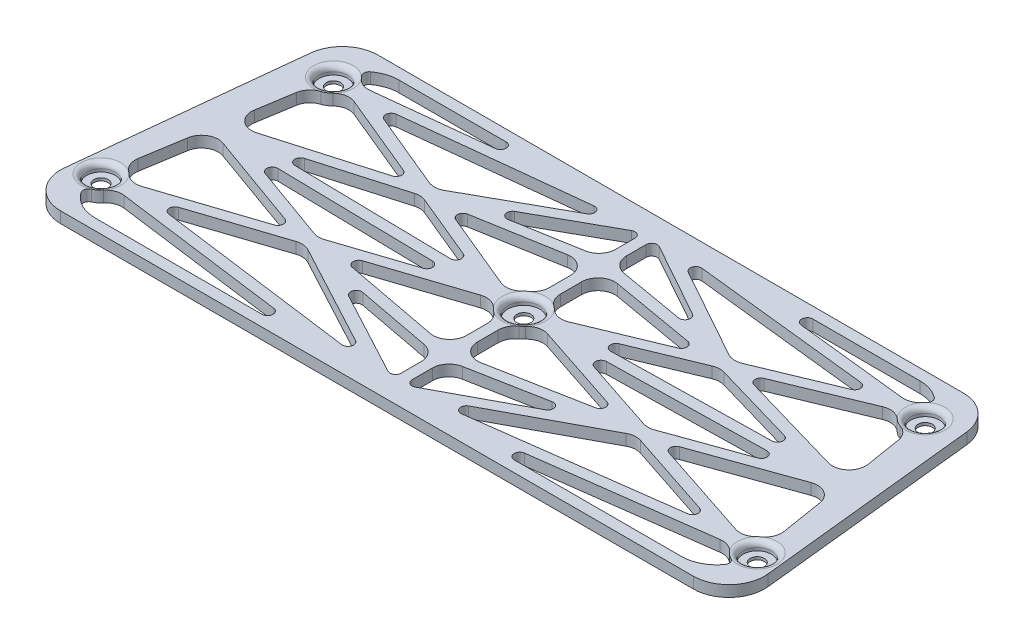
from build123d import *

# Parameters (mm, degrees)
SKETCH1_R                 = 2.032
PLATW_DEPTH               = 3.175
FILLET1_R                 = 10.16
FILLET2_R                 = 10.16
SKETCH2_R                 = 4.064
SKETCH2_R_2               = 4.572
COUNTERSINKS_DEPTH        = 2.38125
POCKET_1_DEPTH            = 109.902861922
ACUTE_ANGLES_R            = 1.5875
FILLET5_R                 = 4.7625
ACUTE_ANGLES_OF_MIRROR1_R = 1.5875
FILLET5_OF_MIRROR1_R      = 4.7625
FILLET6_R                 = 1.5875


with BuildPart() as part:
    # Sketch1 → platw (new body)
    with BuildSketch(Plane(origin=(0, 0, 0), x_dir=(1, 0, 0), z_dir=(0, 1, 0))):
        Polygon((-92.71, 41.91), (-101.6, -41.91), (101.6, -41.91), (92.71, 41.91), align=None)
        with Locations(Location((-93.6752, -27.02052, 0), (0, 0, 270))):
            Circle(SKETCH1_R, mode=Mode.SUBTRACT)
        with Locations(Location((93.6752, -27.02052, 0), (0, 0, 270))):
            Circle(SKETCH1_R, mode=Mode.SUBTRACT)
        with Locations(Location((0, 0, 0), (0, 0, 270))):
            Circle(SKETCH1_R, mode=Mode.SUBTRACT)
        with Locations(Location((-84.4677, 30.12948, 0), (0, 0, 270))):
            Circle(SKETCH1_R, mode=Mode.SUBTRACT)
        with Locations(Location((84.4677, 30.12948, 0), (0, 0, 270))):
            Circle(SKETCH1_R, mode=Mode.SUBTRACT)
    extrude(amount=PLATW_DEPTH)

    # Fillet1
    fillet1_edges = [part.edges().sort_by_distance(p)[0] for p in [
        (-101.6, 1.5875, 41.91),
        (101.6, 1.5875, 41.91),
    ]]
    fillet(fillet1_edges, radius=FILLET1_R)

    # Fillet2
    fillet2_edges = [part.edges().sort_by_distance(p)[0] for p in [
        (-92.71, 1.5875, -41.91),
        (92.71, 1.5875, -41.91),
    ]]
    fillet(fillet2_edges, radius=FILLET2_R)

    # Sketch2 → countersinks (cut)
    with BuildSketch(Plane(origin=(0, 3.175, 0), x_dir=(1, 0, 0), z_dir=(0, 1, 0))):
        with Locations(Location((-84.4677, 30.12948, 0), (0, 0, 270))):
            Circle(SKETCH2_R)
        with Locations(Location((-93.6752, -27.02052, 0), (0, 0, 270))):
            Circle(SKETCH2_R)
        with Locations(Location((93.6752, -27.02052, 0), (0, 0, 270))):
            Circle(SKETCH2_R)
        with Locations(Location((84.4677, 30.12948, 0), (0, 0, 270))):
            Circle(SKETCH2_R)
        with Locations(Location((0, 0, 0), (0, 0, 270))):
            Circle(SKETCH2_R_2)
    extrude(amount=-COUNTERSINKS_DEPTH, mode=Mode.SUBTRACT)

    # Sketch3 → pocket 1 (cut, through all)
    with BuildSketch(Plane(origin=(0, 3.175, 0), x_dir=(1, 0, 0), z_dir=(0, 1, 0))):
        with BuildLine():
            ThreePointArc((-74.364764768, 38.735), (-78.591201304, 37.82143755), (-82.063014065, 35.243865379))
            ThreePointArc((-82.063014065, 35.243865379), (-80.169437747, 33.798866033), (-79.039395327, 31.702044984))
            Line((-79.039395327, 31.702044984), (-14.625996814, 38.735))
            Line((-14.625996814, 38.735), (-74.364764768, 38.735))
        make_face()
        Polygon((-42.58936275, 16.825418377), (-72.487275485, 29.223566982), (-7.622235656, 36.305834302), align=None)
        Polygon((-1.5875, 23.782698651), (-1.5875, 36.033361538), (-33.544297419, 18.230020026), align=None)
        Polygon((-14.510286346, 1.744344238), (-78.575962572, 2.945483668), (-42.581032589, 13.384798421), align=None)
        with BuildLine():
            ThreePointArc((-79.053425075, 28.509270356), (-81.465003698, 25.341655111), (-85.366627548, 24.549929703))
            Line((-85.366627548, 24.549929703), (-88.792093639, 3.288416033))
            Line((-88.792093639, 3.288416033), (-47.272123562, 15.330112916))
            Line((-47.272123562, 15.330112916), (-79.053425075, 28.509270356))
        make_face()
        with BuildLine():
            ThreePointArc((-5.940520688, 1.627775848), (-4.34064828, 4.370150199), (-1.5875, 5.951410253))
            Line((-1.5875, 5.951410253), (-1.5875, 20.560126711))
            Line((-1.5875, 20.560126711), (-36.829028324, 14.436707069))
            Line((-36.829028324, 14.436707069), (-5.940520688, 1.627775848))
        make_face()
        Polygon((-47.069994654, -11.831390316), (-15.504079367, -1.412581541), (-79.443911185, -0.213801513), align=None)
        with BuildLine():
            Line((-51.96640923, -13.44752616), (-89.328331869, -0.039959186))
            Line((-89.328331869, -0.039959186), (-92.776272452, -21.440969703))
            ThreePointArc((-92.776272452, -21.440969703), (-89.939627792, -22.779653045), (-88.253688461, -25.424692666))
            Line((-88.253688461, -25.424692666), (-51.96640923, -13.44752616))
        make_face()
        Polygon((-8.451707544, -36.008722774), (-47.240798441, -15.231243718), (-80.956343198, -26.359570282), align=None)
        Polygon((-1.5875, -36.083749172), (-1.5875, -23.761810906), (-37.213033792, -17.00083784), align=None)
        with BuildLine():
            Line((-1.5875, -20.530141224), (-1.5875, -5.951410253))
            ThreePointArc((-1.5875, -5.951410253), (-4.350190086, -4.360652069), (-5.947579819, -1.601791044))
            Line((-5.947579819, -1.601791044), (-40.767446467, -13.094615785))
            Line((-40.767446467, -13.094615785), (-1.5875, -20.530141224))
        make_face()
        with BuildLine():
            Line((-12.033794896, -38.735), (-88.246680031, -28.592341618))
            ThreePointArc((-88.246680031, -28.592341618), (-90.007286578, -31.320038971), (-92.978310183, -32.628888464))
            ThreePointArc((-92.978310183, -32.628888464), (-89.251887548, -37.071588185), (-83.696991725, -38.735))
            Line((-83.696991725, -38.735), (-12.033794896, -38.735))
        make_face()
    pocket_1 = extrude(amount=-POCKET_1_DEPTH, mode=Mode.SUBTRACT)

    # acute angles
    acute_angles_edges = [part.edges().sort_by_distance(p)[0] for p in [
        (-36.829028324, 1.5875, -14.436707069),
        (-15.504079367, 1.5875, 1.412581541),
        (-79.443911185, 1.5875, 0.213801513),
        (-8.451707544, 1.5875, 36.008722774),
        (-80.956343198, 1.5875, 26.359570282),
        (-51.96640923, 1.5875, 13.44752616),
        (-1.5875, 1.5875, -36.033361538),
        (-33.544297419, 1.5875, -18.230020026),
        (-72.487275485, 1.5875, -29.223566982),
        (-7.622235656, 1.5875, -36.305834302),
        (-47.272123562, 1.5875, -15.330112916),
        (-14.510286346, 1.5875, -1.744344238),
        (-78.575962572, 1.5875, -2.945483668),
        (-12.033794896, 1.5875, 38.735),
        (-92.978310183, 1.5875, 32.628888464),
        (-1.5875, 1.5875, 36.083749172),
        (-37.213033792, 1.5875, 17.00083784),
        (-40.767446467, 1.5875, 13.094615785),
        (-82.063014065, 1.5875, -35.243865379),
        (-14.625996814, 1.5875, -38.735),
    ]]
    fillet(acute_angles_edges, radius=ACUTE_ANGLES_R)

    # Fillet5
    fillet5_edges = [part.edges().sort_by_distance(p)[0] for p in [
        (-1.5875, 1.5875, -5.951410253),
        (-5.940520688, 1.5875, -1.627775848),
        (-1.5875, 1.5875, -20.560126711),
        (-47.069994654, 1.5875, 11.831390316),
        (-47.240798441, 1.5875, 15.231243718),
        (-92.776272452, 1.5875, 21.440969703),
        (-89.328331869, 1.5875, 0.039959186),
        (-88.253688461, 1.5875, 25.424692666),
        (-1.5875, 1.5875, -23.782698651),
        (-42.58936275, 1.5875, -16.825418377),
        (-85.366627548, 1.5875, -24.549929703),
        (-79.053425075, 1.5875, -28.509270356),
        (-88.792093639, 1.5875, -3.288416033),
        (-42.581032589, 1.5875, -13.384798421),
        (-88.246680031, 1.5875, 28.592341618),
        (-1.5875, 1.5875, 23.761810906),
        (-5.947579819, 1.5875, 1.601791044),
        (-1.5875, 1.5875, 5.951410253),
        (-1.5875, 1.5875, 20.530141224),
        (-79.039395327, 1.5875, -31.702044984),
    ]]
    fillet(fillet5_edges, radius=FILLET5_R)

    # Mirror1: pocket 1 across plane
    add(pocket_1.mirror(Plane.ZY), mode=Mode.SUBTRACT)

    # acute angles of Mirror1
    acute_angles_of_mirror1_edges = [part.edges().sort_by_distance(p)[0] for p in [
        (36.829028324, 1.5875, -14.436707069),
        (15.504079367, 1.5875, 1.412581541),
        (79.443911185, 1.5875, 0.213801513),
        (8.451707544, 1.5875, 36.008722774),
        (80.956343198, 1.5875, 26.359570282),
        (51.96640923, 1.5875, 13.44752616),
        (1.5875, 1.5875, -36.033361538),
        (33.544297419, 1.5875, -18.230020026),
        (72.487275485, 1.5875, -29.223566982),
        (7.622235656, 1.5875, -36.305834302),
        (47.272123562, 1.5875, -15.330112916),
        (14.510286346, 1.5875, -1.744344238),
        (78.575962572, 1.5875, -2.945483668),
        (12.033794896, 1.5875, 38.735),
        (92.978310183, 1.5875, 32.628888464),
        (1.5875, 1.5875, 36.083749172),
        (37.213033792, 1.5875, 17.00083784),
        (40.767446467, 1.5875, 13.094615785),
        (82.063014065, 1.5875, -35.243865379),
        (14.625996814, 1.5875, -38.735),
    ]]
    fillet(acute_angles_of_mirror1_edges, radius=ACUTE_ANGLES_OF_MIRROR1_R)

    # Fillet5 of Mirror1
    fillet5_of_mirror1_edges = [part.edges().sort_by_distance(p)[0] for p in [
        (1.5875, 1.5875, -5.951410253),
        (5.940520688, 1.5875, -1.627775848),
        (1.5875, 1.5875, -20.560126711),
        (47.069994654, 1.5875, 11.831390316),
        (47.240798441, 1.5875, 15.231243718),
        (92.776272452, 1.5875, 21.440969703),
        (89.328331869, 1.5875, 0.039959186),
        (88.253688461, 1.5875, 25.424692666),
        (1.5875, 1.5875, -23.782698651),
        (42.58936275, 1.5875, -16.825418377),
        (85.366627548, 1.5875, -24.549929703),
        (79.053425075, 1.5875, -28.509270356),
        (88.792093639, 1.5875, -3.288416033),
        (42.581032589, 1.5875, -13.384798421),
        (88.246680031, 1.5875, 28.592341618),
        (1.5875, 1.5875, 23.761810906),
        (5.947579819, 1.5875, 1.601791044),
        (1.5875, 1.5875, 5.951410253),
        (1.5875, 1.5875, 20.530141224),
        (79.039395327, 1.5875, -31.702044984),
    ]]
    fillet(fillet5_of_mirror1_edges, radius=FILLET5_OF_MIRROR1_R)

    # Fillet6
    fillet6_edges = [part.edges().sort_by_distance(p)[0] for p in [
        (0, 3.175, -4.572),
        (84.4677, 3.175, -34.19348),
        (93.6752, 3.175, 22.95652),
        (-93.6752, 3.175, 22.95652),
        (-84.4677, 3.175, -34.19348),
    ]]
    fillet(fillet6_edges, radius=FILLET6_R - 0.0001)  # a hair under: the kernel refuses the full size


solid = part.part
